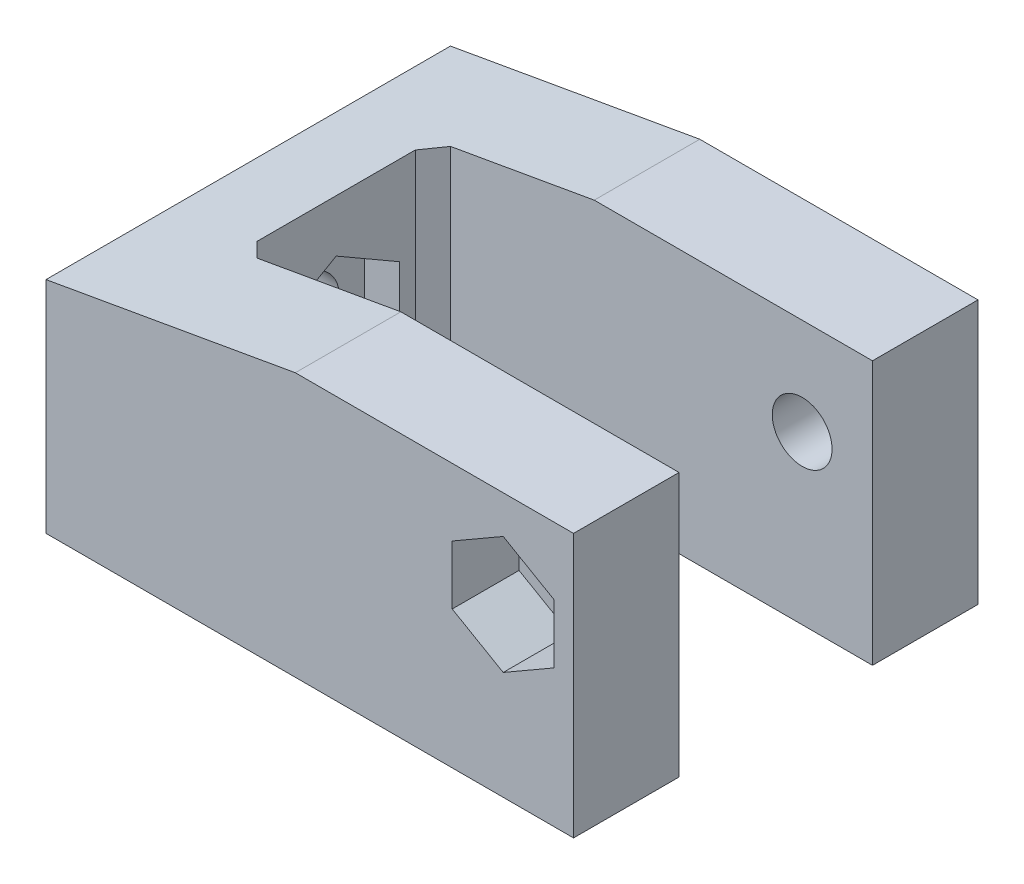
from build123d import *

# Parameters (mm, degrees)
SKETCH1_W               = 23
SKETCH1_H               = 15
BOSS_EXTRUDE1_DEPTH     = 30
SKETCH2_W               = 11
SKETCH2_H               = 15
CUT_EXTRUDE1_DEPTH      = 25
CUT_EXTRUDE2_DEPTH      = 41.669398815
CUT_EXTRUDE2_DEPTH_BACK = 41.669398815
SKETCH3_R               = 1.7
CHAMFER1_SIZE           = 2.5
CHAMFER1_SIZE_2         = 14.178204549
SKETCH4_R               = 2.2
CUT_EXTRUDE3_DEPTH      = 10
CUT_EXTRUDE4_DEPTH      = 2
SKETCH6_R               = 3.25
CUT_EXTRUDE5_DEPTH      = 2.5
CUT_EXTRUDE6_DEPTH      = 3.8
CHAMFER3_SIZE           = 1


with BuildPart() as part:
    # Sketch1 → Boss-Extrude1 (new body)
    with BuildSketch(Plane(origin=(0, 0, 0), x_dir=(0, 0, -1), z_dir=(1, 0, 0))):
        with Locations((11.5, 7.5)):
            Rectangle(SKETCH1_W, SKETCH1_H)
    extrude(amount=BOSS_EXTRUDE1_DEPTH)

    # Sketch2 → Cut-Extrude1 (cut)
    with BuildSketch(Plane(origin=(30, 0, 0), x_dir=(0, 0, -1), z_dir=(1, 0, 0))):
        with Locations((11.5, 7.5)):
            Rectangle(SKETCH2_W, SKETCH2_H)
    extrude(amount=-CUT_EXTRUDE1_DEPTH, mode=Mode.SUBTRACT)

    # Sketch3 → Cut-Extrude2 (cut, two sides: drawn at the far end of the back side and taken through both)
    with BuildSketch(Plane(origin=(0, 0, -23), x_dir=(-1, 0, 0), z_dir=(0, 0, -1)).offset(-CUT_EXTRUDE2_DEPTH_BACK)):
        with Locations(Location((-26, 9.5, 0), (0, 0, 90))):
            Circle(SKETCH3_R)
    extrude(amount=CUT_EXTRUDE2_DEPTH + CUT_EXTRUDE2_DEPTH_BACK, mode=Mode.SUBTRACT)

    # Chamfer1
    # the kernel refuses this chamfer: 14.178204549, 2.5 mm, written as the material it takes off along each edge
    with BuildSketch(Plane(origin=(0, 15, -59.842614584), x_dir=(-0.21013876076743537, -0.9776715712462578, 0), z_dir=(0, 0, 1))) as chamfer1_piece_1:
        Polygon((CHAMFER1_SIZE * 0.977671571246, CHAMFER1_SIZE * 0.210138760767), (-CHAMFER1_SIZE_2 * 0.210138760768, CHAMFER1_SIZE_2 * 0.977671571249), (0, 0), align=None)
    extrude(amount=96.685229169, mode=Mode.SUBTRACT)

    # Sketch4 → Cut-Extrude3 (cut)
    with BuildSketch(Plane.ZY):
        with Locations((-11.5, 6.25)):
            Circle(SKETCH4_R)
    extrude(amount=-CUT_EXTRUDE3_DEPTH, mode=Mode.SUBTRACT)

    # Sketch5 → Cut-Extrude4 (cut)
    with BuildSketch(Plane(origin=(5, 0, 0), x_dir=(0, 0, -1), z_dir=(1, 0, 0))):
        Polygon((7.9, 8.328460969), (7.9, 4.171539031), (11.5, 2.093078062), (15.1, 4.171539031), (15.1, 8.328460969), (11.5, 10.406921938), align=None)
    extrude(amount=-CUT_EXTRUDE4_DEPTH, mode=Mode.SUBTRACT)

    # Sketch6 → Cut-Extrude5 (cut)
    with BuildSketch(Plane(origin=(0, 0, -23), x_dir=(-1, 0, 0), z_dir=(0, 0, -1))):
        with Locations((-26, 9.5)):
            Circle(SKETCH6_R)
    extrude(amount=-CUT_EXTRUDE5_DEPTH, mode=Mode.SUBTRACT)

    # Sketch7 → Cut-Extrude6 (cut)
    with BuildSketch(Plane.XY):
        Polygon((23.1, 11.174315781), (23.1, 7.825684219), (26, 6.151368439), (28.9, 7.825684219), (28.9, 11.174315781), (26, 12.848631561), align=None)
    extrude(amount=-CUT_EXTRUDE6_DEPTH, mode=Mode.SUBTRACT)

    # Chamfer3
    chamfer3_edges = [part.edges().sort_by_distance(p)[0] for p in [
        (5, 6.690817452, -17),
        (5, 6.690817452, -6),
    ]]
    chamfer(chamfer3_edges, length=CHAMFER3_SIZE)


solid = part.part
